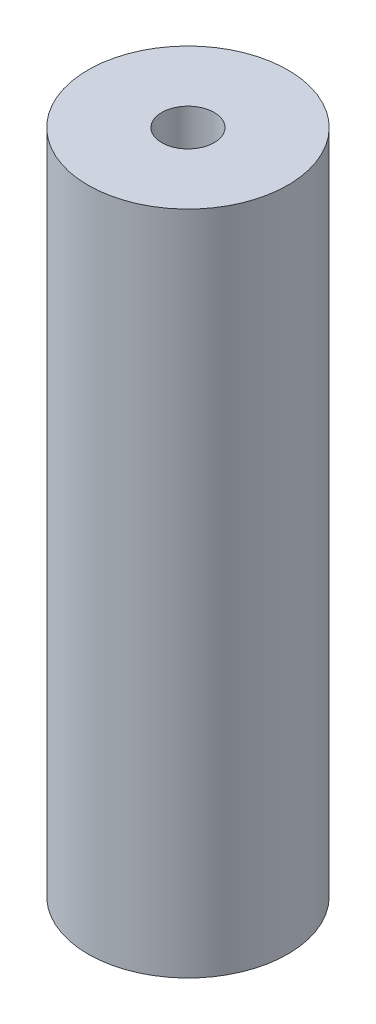
from build123d import *

# Parameters (mm, degrees)
SKETCH1_R                    = 6
BOSS_EXTRUDE1_DEPTH          = 40
TAP_DRILL_FOR_M3_HELICOIL1_D = 3.15


with BuildPart() as part:
    # Sketch1 → Boss-Extrude1 (new body)
    with BuildSketch(Plane(origin=(0, 0, 0), x_dir=(1, 0, 0), z_dir=(0, 1, 0))):
        Circle(SKETCH1_R)
    extrude(amount=BOSS_EXTRUDE1_DEPTH)

    # Tap Drill for M3 Helicoil1 (through all)
    with Locations(Plane(origin=(0, 40, 0), x_dir=(1, 0, 0), z_dir=(0, 1, 0))):
        with Locations((0, 0)):
            Hole(TAP_DRILL_FOR_M3_HELICOIL1_D / 2)


solid = part.part
